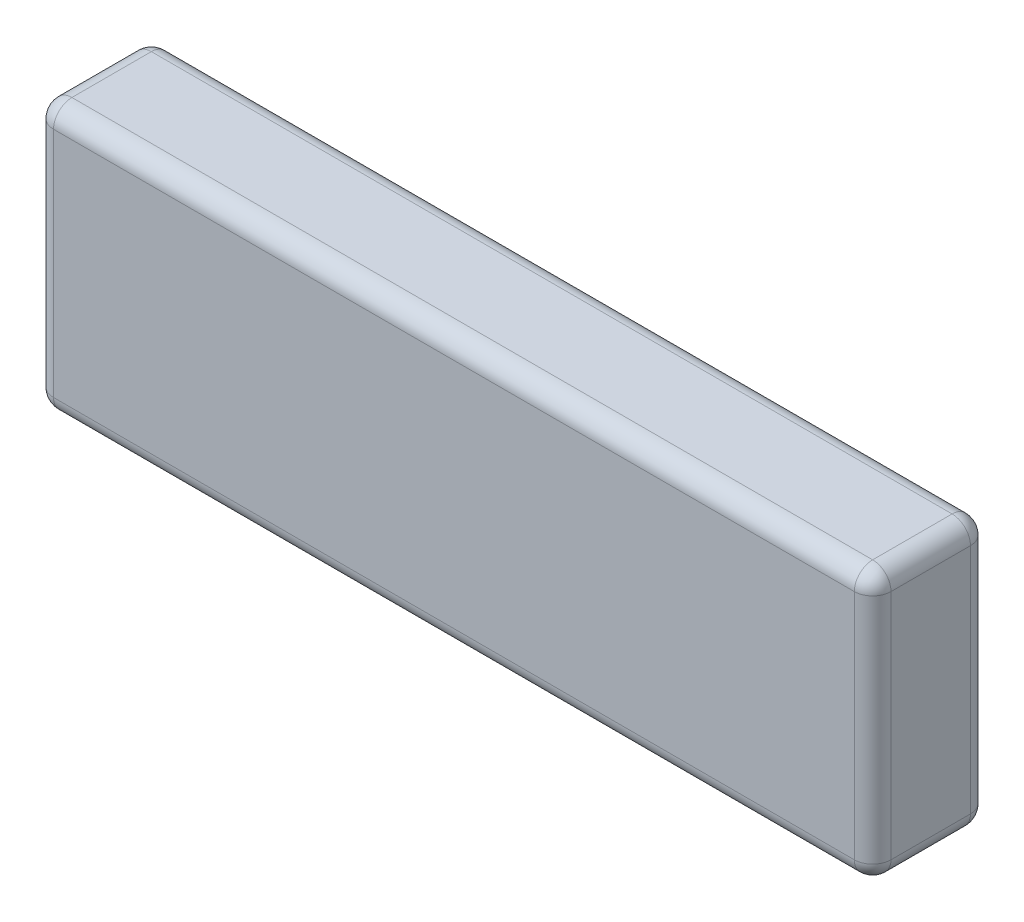
from build123d import *

# Parameters (mm, degrees)
CROQUIS2_W              = 137
CROQUIS2_H              = 44
SALIENTE_EXTRUIR1_DEPTH = 19
REDONDEO3_R             = 3
REDONDEO4_R             = 3
REDONDEO5_R             = 3
REDONDEO6_R             = 3
REDONDEO7_R             = 3


with BuildPart() as part:
    # Croquis2 → Saliente-Extruir1 (new body)
    with BuildSketch(Plane.XY):
        Rectangle(CROQUIS2_W, CROQUIS2_H)
    extrude(amount=SALIENTE_EXTRUIR1_DEPTH)

    # Redondeo3
    redondeo3_edges = [part.edges().sort_by_distance(p)[0] for p in [
        (0, -22, 0),
    ]]
    fillet(redondeo3_edges, radius=REDONDEO3_R)

    # Redondeo4
    redondeo4_edges = [part.edges().sort_by_distance(p)[0] for p in [
        (0, -22, 19),
    ]]
    fillet(redondeo4_edges, radius=REDONDEO4_R)

    # Redondeo5
    redondeo5_edges = [part.edges().sort_by_distance(p)[0] for p in [
        (0, 22, 19),
        (-68.5, 22, 9.5),
    ]]
    fillet(redondeo5_edges, radius=REDONDEO5_R)

    # Redondeo6
    # the kernel refuses this fillet: 3 mm, written as the material it takes off along each edge
    with BuildSketch(Plane(origin=(-65.5, 19, 16), x_dir=(-1, 0, 0), z_dir=(0, 0, 1))) as redondeo6_piece_1_section:
        Polygon((0, 0), (REDONDEO6_R, 0), (REDONDEO6_R, -REDONDEO6_R), (0, -REDONDEO6_R), align=None)
    redondeo6_piece_1 = extrude(amount=REDONDEO6_R, mode=Mode.PRIVATE)
    redondeo6_piece_1 = redondeo6_piece_1 - Plane(origin=(-65.5, 19, 16), x_dir=(0.7071067811865475, -0.7071067811865475, 0), z_dir=(0, 0, 1)) * Sphere(REDONDEO6_R, mode=Mode.PRIVATE)
    add(redondeo6_piece_1, mode=Mode.SUBTRACT)
    with BuildSketch(Plane(origin=(-68.5, -19, 3), x_dir=(0, -1, 0), z_dir=(0, 0, 1))) as redondeo6_piece_2:
        with BuildLine():
            CenterArc((3 - REDONDEO6_R, REDONDEO6_R), REDONDEO6_R, 270, 90)
            Line((3 - REDONDEO6_R, 0), (3, 0))
            Line((3, 0), (3, REDONDEO6_R))
        make_face()
    revolve(axis=Axis((-68.5, -19, 3), (1, 0, 0)), revolution_arc=90, mode=Mode.SUBTRACT)
    with BuildSketch(Plane(origin=(-68.5, -22, 3), x_dir=(1, 0, 0), z_dir=(0, 0, 1))) as redondeo6_piece_3:
        with BuildLine():
            CenterArc((REDONDEO6_R, REDONDEO6_R), REDONDEO6_R, 180, 90)
            Line((0, REDONDEO6_R), (0, 0))
            Line((0, 0), (REDONDEO6_R, 0))
        make_face()
    extrude(amount=13, mode=Mode.SUBTRACT)
    with BuildSketch(Plane(origin=(-68.5, -19, 16), x_dir=(0, -1, 0), z_dir=(0, 0, -1))) as redondeo6_piece_4:
        with BuildLine():
            CenterArc((3 - REDONDEO6_R, -REDONDEO6_R), REDONDEO6_R, 0, 90)
            Line((3 - REDONDEO6_R, 0), (3, 0))
            Line((3, 0), (3, -REDONDEO6_R))
        make_face()
    revolve(axis=Axis((-68.5, -19, 16), (-1, 0, 0)), revolution_arc=90, mode=Mode.SUBTRACT)
    with BuildSketch(Plane(origin=(-68.5, -19, 19), x_dir=(1, 0, 0), z_dir=(0, 1, 0))) as redondeo6_piece_5:
        with BuildLine():
            CenterArc((REDONDEO6_R, REDONDEO6_R), REDONDEO6_R, 180, 90)
            Line((0, REDONDEO6_R), (0, 0))
            Line((0, 0), (REDONDEO6_R, 0))
        make_face()
    extrude(amount=38, mode=Mode.SUBTRACT)
    with BuildSketch(Plane(origin=(-68.5, -19, 0), x_dir=(1, 0, 0), z_dir=(0, 1, 0))) as redondeo6_piece_6:
        with BuildLine():
            CenterArc((REDONDEO6_R, -REDONDEO6_R), REDONDEO6_R, 90, 90)
            Line((0, -REDONDEO6_R), (0, 0))
            Line((0, 0), (REDONDEO6_R, 0))
        make_face()
    extrude(amount=38, mode=Mode.SUBTRACT)
    with BuildSketch(Plane(origin=(-65.5, 19, 0), x_dir=(-1, 0, 0), z_dir=(0, -1, 0))) as redondeo6_piece_7:
        with BuildLine():
            CenterArc((3 - REDONDEO6_R, -REDONDEO6_R), REDONDEO6_R, 0, 90)
            Line((3, -REDONDEO6_R), (3, 0))
            Line((3, 0), (3 - REDONDEO6_R, 0))
        make_face()
    revolve(axis=Axis((-65.5, 19, 0), (0, 0, -1)), revolution_arc=90, mode=Mode.SUBTRACT)
    with BuildSketch(Plane(origin=(-65.5, 22, 0), x_dir=(0, 0, 1), z_dir=(1, 0, 0))) as redondeo6_piece_8:
        with BuildLine():
            CenterArc((REDONDEO6_R, REDONDEO6_R), REDONDEO6_R, 180, 90)
            Line((0, REDONDEO6_R), (0, 0))
            Line((0, 0), (REDONDEO6_R, 0))
        make_face()
    extrude(amount=141.5, mode=Mode.SUBTRACT)

    # Redondeo7
    redondeo7_edges = [part.edges().sort_by_distance(p)[0] for p in [
        (68.5, 0, 0),
        (68.5, -21.121320344, 0.878679656),
        (68.5, -22, 9.5),
        (68.5, 0, 19),
        (68.5, -21.121320344, 18.121320344),
        (68.5, 22, 9.5),
        (68.5, 21.121320344, 18.121320344),
        (68.5, 21.121320344, 0.878679656),
    ]]
    fillet(redondeo7_edges, radius=REDONDEO7_R)


solid = part.part
